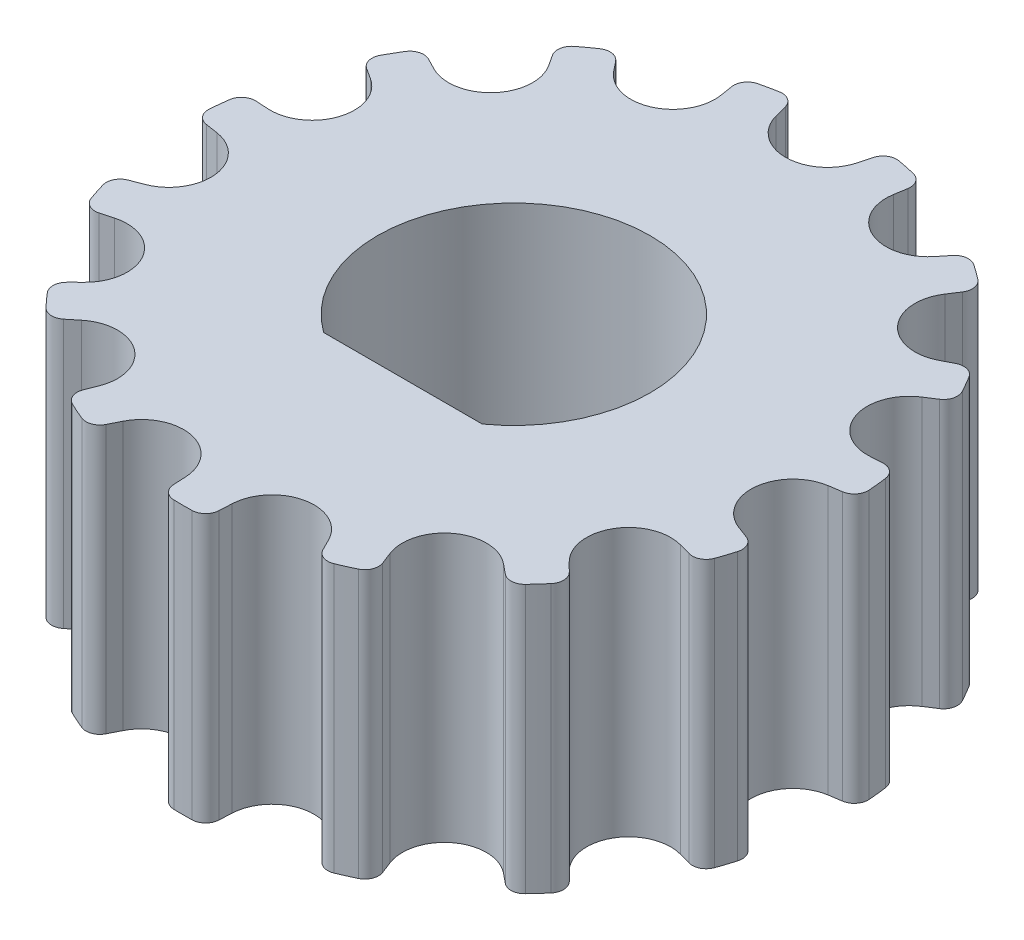
from build123d import *

# Parameters (mm, degrees)
SKETCH1_R           = 7.161972439
BOSS_EXTRUDE1_DEPTH = 5.8
CUT_EXTRUDE1_DEPTH  = 12.671662197
CIRPATTERN1_COUNT   = 15
CUT_EXTRUDE2_DEPTH  = 12.659198501


with BuildPart() as part:
    # Sketch1 → Boss-Extrude1 (new body)
    with BuildSketch(Plane(origin=(0, 0, 0), x_dir=(1, 0, 0), z_dir=(0, 1, 0))):
        Circle(SKETCH1_R)
    extrude(amount=BOSS_EXTRUDE1_DEPTH)

    # Sketch2 → Cut-Extrude1 (cut, through all)
    with BuildSketch(Plane(origin=(0, 5.8, 0), x_dir=(1, 0, 0), z_dir=(0, 1, 0))):
        with BuildLine():
            Line((-0.879885324, 6.559804793), (-0.95, 6.825530337))
            ThreePointArc((-0.95, 6.825530337), (-1.079308013, 7.002279754), (-1.294287054, 7.044052118))
            ThreePointArc((-1.294287054, 7.044052118), (-2.118539526, 6.841464719), (-2.913036628, 6.54278739))
            Line((-2.913036628, 6.54278739), (-2.913036628, 7.161972439))
            Line((-2.913036628, 7.161972439), (2.913036628, 7.161972439))
            Line((2.913036628, 7.161972439), (2.913036628, 6.54278739))
            ThreePointArc((2.913036628, 6.54278739), (2.118539526, 6.841464719), (1.294287054, 7.044052118))
            ThreePointArc((1.294287054, 7.044052118), (1.079308013, 7.002279754), (0.95, 6.825530337))
            Line((0.95, 6.825530337), (0.879885324, 6.559804793))
            ThreePointArc((0.879885324, 6.559804793), (0, 5.881972439), (-0.879885324, 6.559804793))
        make_face()
    cut_extrude1 = extrude(amount=-CUT_EXTRUDE1_DEPTH, mode=Mode.SUBTRACT)

    # CirPattern1: Cut-Extrude1 ×15 about axis
    cirpattern1_axis = Axis((0, 5.8, 0), (0, -1, 0))
    for i in range(1, CIRPATTERN1_COUNT):
        add(cut_extrude1.rotate(cirpattern1_axis, i * 360 / CIRPATTERN1_COUNT), mode=Mode.SUBTRACT)

    # Sketch3 → Cut-Extrude2 (cut, through all)
    with BuildSketch(Plane.XZ):
        with BuildLine():
            Line((1.71537168, 2.4), (-1.71537168, 2.4))
            ThreePointArc((-1.71537168, 2.4), (0, -2.95), (1.71537168, 2.4))
        make_face()
    extrude(amount=-CUT_EXTRUDE2_DEPTH, mode=Mode.SUBTRACT)


solid = part.part
